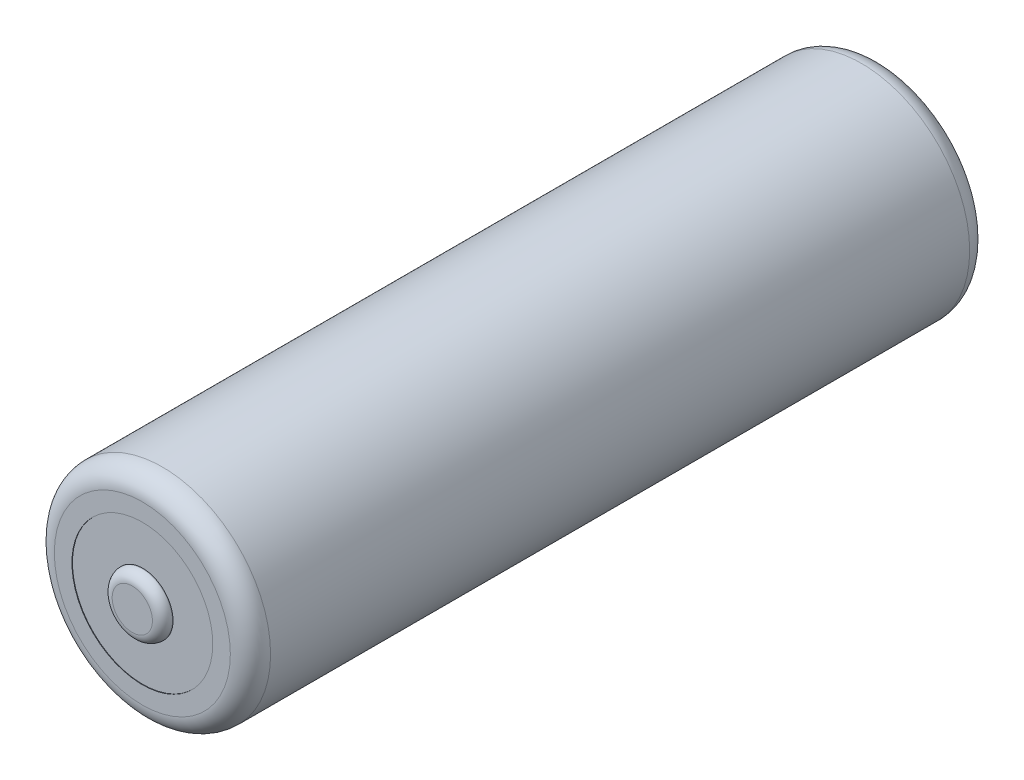
from build123d import *

# Parameters (mm, degrees)
SKETCH1_R           = 10.75
BOSS_EXTRUDE1_DEPTH = 73.5
SKETCH2_R           = 3
BOSS_EXTRUDE2_DEPTH = 1
CUT_EXTRUDE1_START  = -0.05
SKETCH2_3_R         = 7
SKETCH2_3_R_2       = 3
CUT_EXTRUDE1_DEPTH  = 0.05
SKETCH3_R           = 7.5
CUT_EXTRUDE2_DEPTH  = 0.05
FILLET1_R           = 2
FILLET2_R           = 1


with BuildPart() as part:
    # Sketch1 → Boss-Extrude1 (new body)
    with BuildSketch(Plane.XY):
        Circle(SKETCH1_R)
    extrude(amount=BOSS_EXTRUDE1_DEPTH)

    # Sketch2 → Boss-Extrude2 (add)
    with BuildSketch(Plane.XY.offset(73.5)):
        Circle(SKETCH2_R)
    extrude(amount=BOSS_EXTRUDE2_DEPTH)

    # Sketch2<3> → Cut-Extrude1 (cut)
    with BuildSketch(Plane.XY.offset(73.5).offset(CUT_EXTRUDE1_START)):
        Circle(SKETCH2_3_R)
        Circle(SKETCH2_3_R_2, mode=Mode.SUBTRACT)
    extrude(amount=CUT_EXTRUDE1_DEPTH, mode=Mode.SUBTRACT)

    # Sketch3 → Cut-Extrude2 (cut)
    with BuildSketch(Plane(origin=(0, 0, 0), x_dir=(-1, 0, 0), z_dir=(0, 0, -1))):
        Circle(SKETCH3_R)
    extrude(amount=-CUT_EXTRUDE2_DEPTH, mode=Mode.SUBTRACT)

    # Fillet1
    fillet1_edges = [part.edges().sort_by_distance(p)[0] for p in [
        (-10.75, 0, 73.5),
        (-10.75, 0, 0),
    ]]
    fillet(fillet1_edges, radius=FILLET1_R)

    # Fillet2
    fillet2_edges = [part.edges().sort_by_distance(p)[0] for p in [
        (-3, 0, 74.5),
    ]]
    fillet(fillet2_edges, radius=FILLET2_R)


solid = part.part
